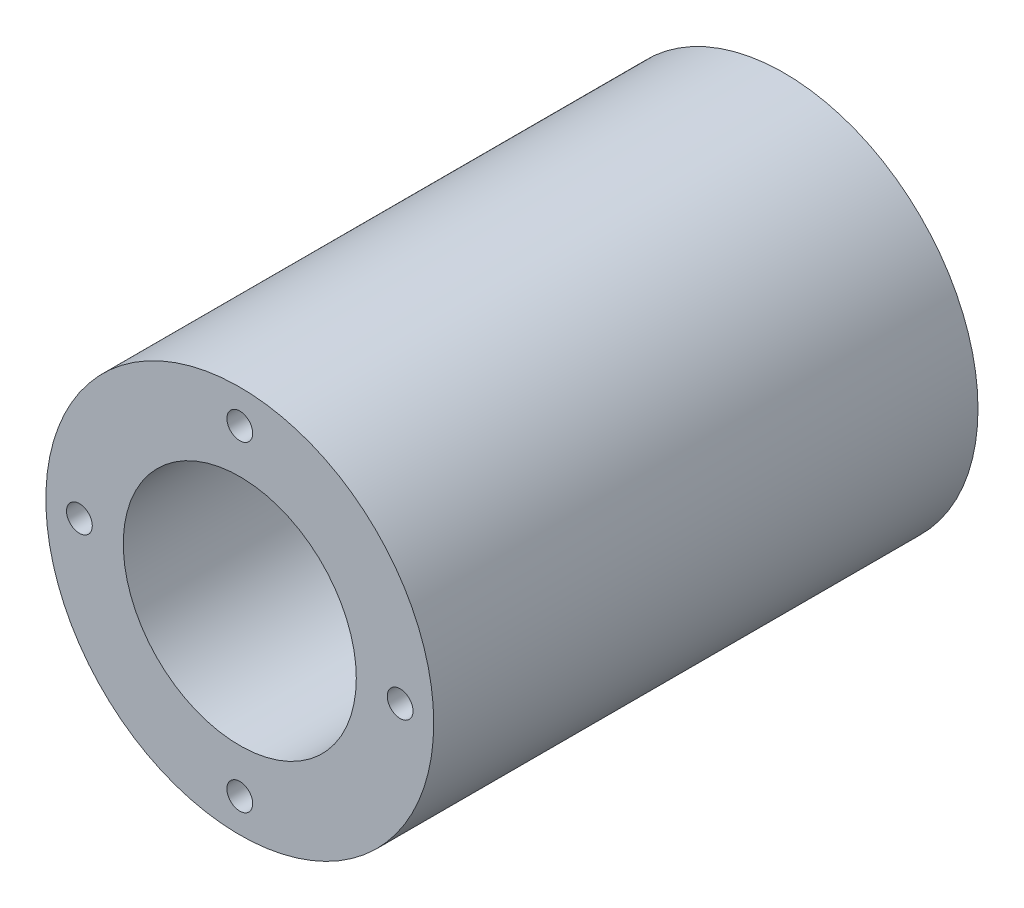
from build123d import *

# Parameters (mm, degrees)
SKETCH1_W              = 105.659000296
SKETCH1_H              = 15.03045
BACKFACEPATTERN_COUNT  = 6
FRONTFACEPATTERN_COUNT = 4
SKETCH7_R              = 26.9875
SKETCH7_R_2            = 24.60625
CUT_EXTRUDE1_DEPTH     = 0.5


with BuildPart() as part:
    # Sketch1 → Revolve1 (revolve)
    with BuildSketch(Plane(origin=(0, 0, 0), x_dir=(0, 0, -1), z_dir=(1, 0, 0))):
        with Locations((-78.454500047, 30.133925)):
            Rectangle(SKETCH1_W, SKETCH1_H)
    revolve(axis=Axis((0, 0, 131.284000195), (0, 0, -1)))

    # Sketch9 → M6x1.0 Tapped Hole3 (revolve, cut)
    with BuildSketch(Plane(origin=(0, 31.133925032, 25.624999899), x_dir=(0, 1, 0), z_dir=(1, 0, 0))):
        Polygon((0, 0), (0, 16.502151548), (2.5, 15), (2.5, 0), align=None)
    m6x1_0_tapped_hole3 = revolve(axis=Axis((0, 31.133925032, 19.274999899), (0, 0, 1)), mode=Mode.SUBTRACT)

    # BackFacePattern: M6x1.0 Tapped Hole3 ×6 about axis
    backfacepattern_axis = Axis((0, 0, 1000), (0, 0, -1))
    for i in range(1, BACKFACEPATTERN_COUNT):
        add(m6x1_0_tapped_hole3.rotate(backfacepattern_axis, i * 360 / BACKFACEPATTERN_COUNT), mode=Mode.SUBTRACT)

    # Sketch6 → M6x1.0 Tapped Hole2 (revolve, cut)
    with BuildSketch(Plane(origin=(0, 31.133925032, 131.284000195), x_dir=(0, -1, 0), z_dir=(1, 0, 0))):
        Polygon((0, 0), (0, 16.502151548), (2.5, 15), (2.5, 0), align=None)
    m6x1_0_tapped_hole2 = revolve(axis=Axis((0, 31.133925032, 137.634000195), (0, 0, -1)), mode=Mode.SUBTRACT)

    # FrontFacePattern: M6x1.0 Tapped Hole2 ×4 about axis
    frontfacepattern_axis = Axis((0, 0, 1000), (0, 0, -1))
    for i in range(1, FRONTFACEPATTERN_COUNT):
        add(m6x1_0_tapped_hole2.rotate(frontfacepattern_axis, i * 360 / FRONTFACEPATTERN_COUNT), mode=Mode.SUBTRACT)

    # Sketch7 → Cut-Extrude1 (cut)
    with BuildSketch(Plane(origin=(0, 0, 25.624999899), x_dir=(-1, 0, 0), z_dir=(0, 0, -1))):
        Circle(SKETCH7_R)
        Circle(SKETCH7_R_2, mode=Mode.SUBTRACT)
    extrude(amount=-CUT_EXTRUDE1_DEPTH, mode=Mode.SUBTRACT)


solid = part.part
